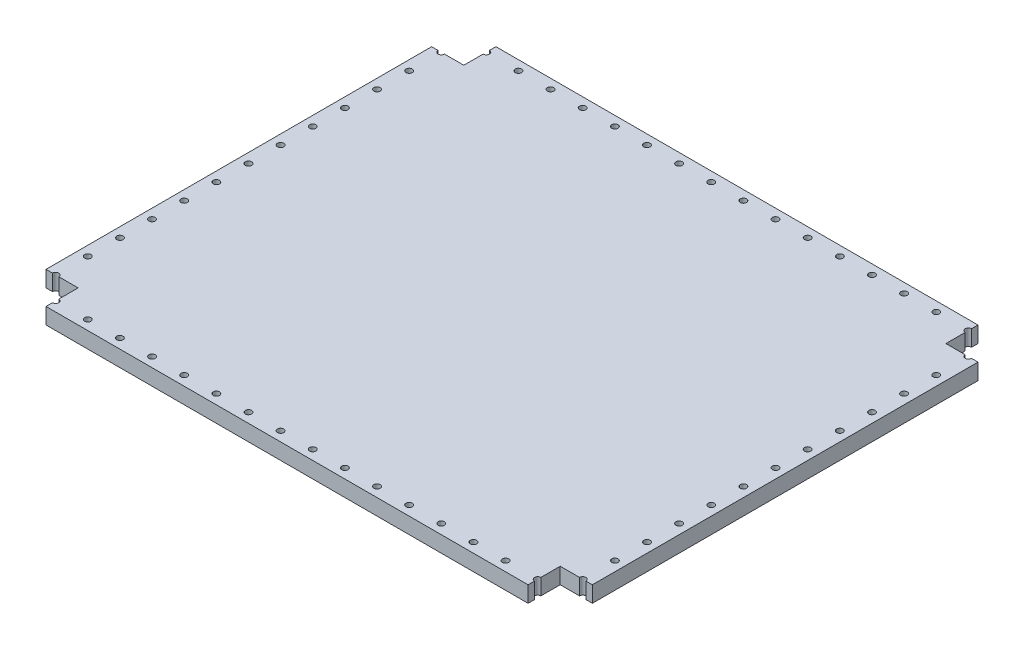
from build123d import *

# Parameters (mm, degrees)
SKETCH1_W           = 431.8
SKETCH1_H           = 355.6
BOSS_EXTRUDE1_DEPTH = 12.7
SKETCH2_R           = 2.5
CUT_EXTRUDE1_DEPTH  = 280.9766776
LPATTERN1_COUNT     = 13
LPATTERN1_PITCH     = 25.4
SKETCH3_R           = 2.5
CUT_EXTRUDE2_DEPTH  = 280.9766776
LPATTERN2_COUNT     = 16
LPATTERN2_PITCH     = 25.4
SKETCH4_R           = 2.5
CUT_EXTRUDE3_DEPTH  = 280.9766776
LPATTERN3_COUNT     = 13
LPATTERN3_PITCH     = 25.4
SKETCH5_R           = 2.5
CUT_EXTRUDE4_DEPTH  = 280.9766776
LPATTERN4_COUNT     = 16
LPATTERN4_PITCH     = 25.4
SKETCH6_W           = 25.4
SKETCH6_H           = 25.4
CUT_EXTRUDE5_DEPTH  = 280.9766776
SKETCH7_W           = 25.4
SKETCH7_H           = 25.4
CUT_EXTRUDE6_DEPTH  = 280.9766776
SKETCH8_W           = 25.4
SKETCH8_H           = 25.4
CUT_EXTRUDE7_DEPTH  = 280.9766776
SKETCH9_W           = 25.4
SKETCH9_H           = 25.4
CUT_EXTRUDE8_DEPTH  = 280.9766776


with BuildPart() as part:
    # Sketch1 → Boss-Extrude1 (new body)
    with BuildSketch(Plane(origin=(0, 0, 0), x_dir=(1, 0, 0), z_dir=(0, 1, 0))):
        Rectangle(SKETCH1_W, SKETCH1_H)
    extrude(amount=BOSS_EXTRUDE1_DEPTH)

    # Sketch2 → Cut-Extrude1 (cut, through all)
    with BuildSketch(Plane(origin=(0, 12.7, 0), x_dir=(1, 0, 0), z_dir=(0, 1, 0))):
        with Locations((-208.28, 152.4)):
            Circle(SKETCH2_R)
    cut_extrude1 = extrude(amount=-CUT_EXTRUDE1_DEPTH, mode=Mode.SUBTRACT)

    # LPattern1: Cut-Extrude1 ×13
    with Locations(*[(0, 0, i * LPATTERN1_PITCH) for i in range(1, LPATTERN1_COUNT)]):
        add(cut_extrude1, mode=Mode.SUBTRACT)

    # Sketch3 → Cut-Extrude2 (cut, through all)
    with BuildSketch(Plane(origin=(0, 12.7, 0), x_dir=(1, 0, 0), z_dir=(0, 1, 0))):
        with Locations((-190.5, 170.18)):
            Circle(SKETCH3_R)
    cut_extrude2 = extrude(amount=-CUT_EXTRUDE2_DEPTH, mode=Mode.SUBTRACT)

    # LPattern2: Cut-Extrude2 ×16
    with Locations(*[(i * LPATTERN2_PITCH, 0, 0) for i in range(1, LPATTERN2_COUNT)]):
        add(cut_extrude2, mode=Mode.SUBTRACT)

    # Sketch4 → Cut-Extrude3 (cut, through all)
    with BuildSketch(Plane(origin=(0, 12.7, 0), x_dir=(1, 0, 0), z_dir=(0, 1, 0))):
        with Locations((208.28, 152.4)):
            Circle(SKETCH4_R)
    cut_extrude3 = extrude(amount=-CUT_EXTRUDE3_DEPTH, mode=Mode.SUBTRACT)

    # LPattern3: Cut-Extrude3 ×13
    with Locations(*[(0, 0, i * LPATTERN3_PITCH) for i in range(1, LPATTERN3_COUNT)]):
        add(cut_extrude3, mode=Mode.SUBTRACT)

    # Sketch5 → Cut-Extrude4 (cut, through all)
    with BuildSketch(Plane(origin=(0, 12.7, 0), x_dir=(1, 0, 0), z_dir=(0, 1, 0))):
        with Locations((190.5, -170.18)):
            Circle(SKETCH5_R)
    cut_extrude4 = extrude(amount=-CUT_EXTRUDE4_DEPTH, mode=Mode.SUBTRACT)

    # LPattern4: Cut-Extrude4 ×16
    with Locations(*[(-i * LPATTERN4_PITCH, 0, 0) for i in range(1, LPATTERN4_COUNT)]):
        add(cut_extrude4, mode=Mode.SUBTRACT)

    # Sketch6 → Cut-Extrude5 (cut, through all)
    with BuildSketch(Plane(origin=(0, 12.7, 0), x_dir=(1, 0, 0), z_dir=(0, 1, 0))):
        with Locations((-203.2, 165.1)):
            Rectangle(SKETCH6_W, SKETCH6_H)
    extrude(amount=-CUT_EXTRUDE5_DEPTH, mode=Mode.SUBTRACT)

    # Sketch7 → Cut-Extrude6 (cut, through all)
    with BuildSketch(Plane(origin=(0, 12.7, 0), x_dir=(1, 0, 0), z_dir=(0, 1, 0))):
        with Locations((-203.2, -165.1)):
            Rectangle(SKETCH7_W, SKETCH7_H)
    extrude(amount=-CUT_EXTRUDE6_DEPTH, mode=Mode.SUBTRACT)

    # Sketch8 → Cut-Extrude7 (cut, through all)
    with BuildSketch(Plane(origin=(0, 12.7, 0), x_dir=(1, 0, 0), z_dir=(0, 1, 0))):
        with Locations((203.2, -165.1)):
            Rectangle(SKETCH8_W, SKETCH8_H)
    extrude(amount=-CUT_EXTRUDE7_DEPTH, mode=Mode.SUBTRACT)

    # Sketch9 → Cut-Extrude8 (cut, through all)
    with BuildSketch(Plane(origin=(0, 12.7, 0), x_dir=(1, 0, 0), z_dir=(0, 1, 0))):
        with Locations((203.2, 165.1)):
            Rectangle(SKETCH9_W, SKETCH9_H)
    extrude(amount=-CUT_EXTRUDE8_DEPTH, mode=Mode.SUBTRACT)


solid = part.part
